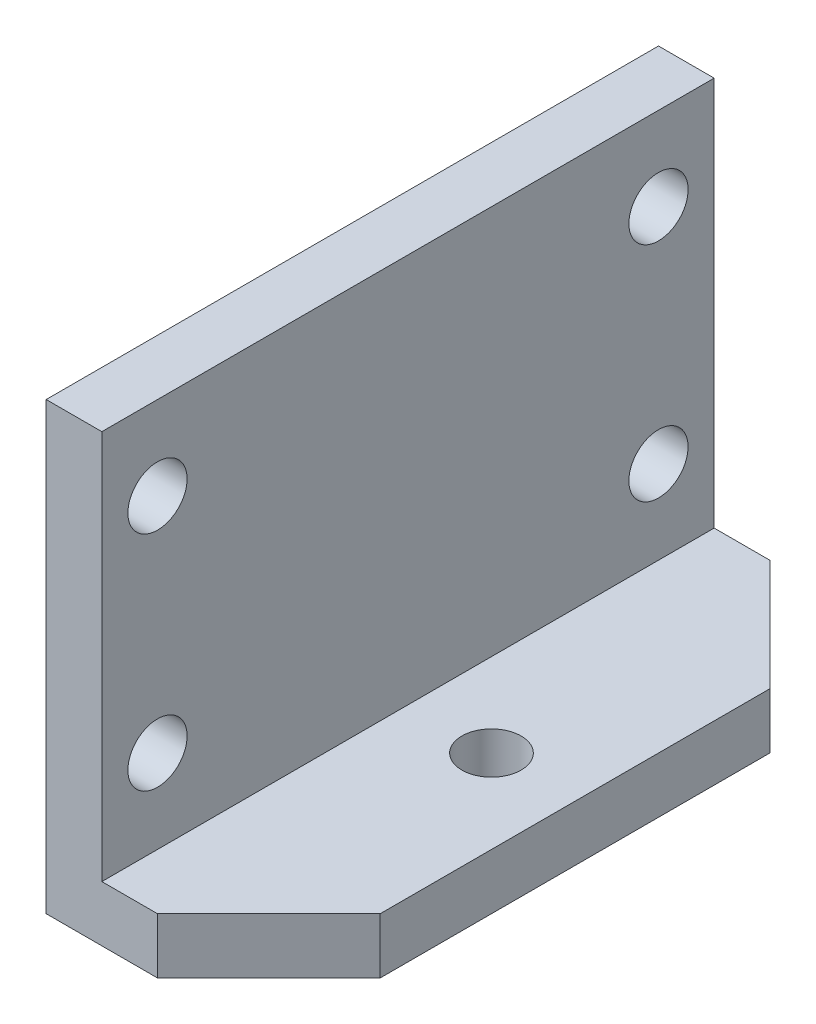
from build123d import *

# Parameters (mm, degrees)
BOSS_EXTRUDE1_DEPTH     = 34.925
F_1_4_CLEARANCE_HOLE1_D = 6.7564
F_1_4_CLEARANCE_HOLE2_D = 6.7564
CHAMFER1_SIZE           = 12.7


with BuildPart() as part:
    # Sketch1 → Boss-Extrude1 (new, symmetric)
    with BuildSketch(Plane.XY):
        Polygon((0, 50.8), (0, 0), (25.4, 0), (25.4, 6.35), (6.35, 6.35), (6.35, 50.8), align=None)
    extrude(amount=BOSS_EXTRUDE1_DEPTH, both=True)

    # 1/4 Clearance Hole1 (through all)
    with Locations(Plane.ZY):
        with Locations((-28.575, 15.875), (28.575, 15.875), (-28.575, 41.275), (28.575, 41.275)):
            Hole(F_1_4_CLEARANCE_HOLE1_D / 2)

    # 1/4 Clearance Hole2 (through all)
    with Locations(Plane(origin=(0, 6.35, 0), x_dir=(1, 0, 0), z_dir=(0, 1, 0))):
        with Locations((15.875, 0)):
            Hole(F_1_4_CLEARANCE_HOLE2_D / 2)

    # Chamfer1
    chamfer1_edges = [part.edges().sort_by_distance(p)[0] for p in [
        (25.4, 3.175, -34.925),
        (25.4, 3.175, 34.925),
    ]]
    chamfer(chamfer1_edges, length=CHAMFER1_SIZE)


solid = part.part
